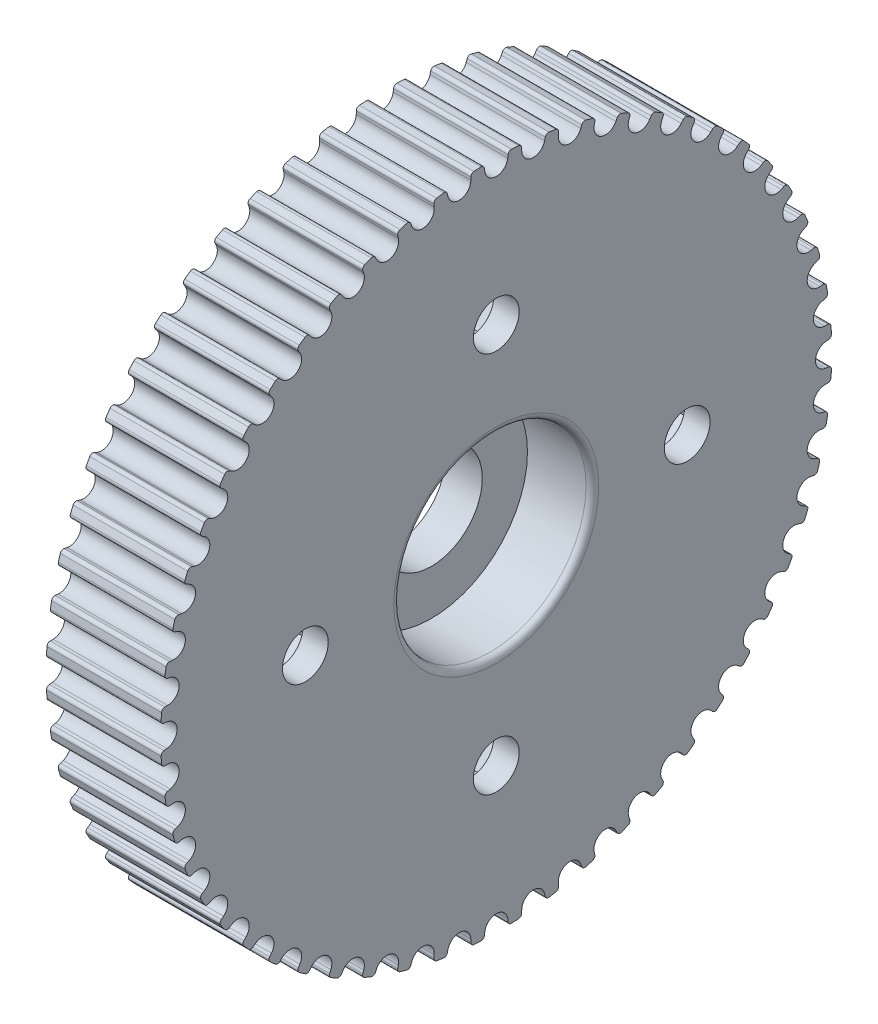
from build123d import *

# Parameters (mm, degrees)
CUT_EXTRUDE_2_REACH       = 40.348
PATTERN_CIRCULAR_3_COUNT  = 56
SKETCH_7_R                = 21.25
CUT_EXTRUDE_4_DEPTH       = 5
CHAMFER_1_SIZE            = 1
SKETCH_11_R               = 12.5
EXTRUDE_2_DEPTH           = 4
SKETCH_12_R               = 4
CUT_EXTRUDE_8_DEPTH       = 32
CHAMFER_3_SIZE            = 1
SKETCH_13_R               = 1.8
CUT_EXTRUDE_9_DEPTH       = 50
CUT_EXTRUDE_11_DEPTH      = 8
CUT_EXTRUDE_11_DEPTH_BACK = 2
SKETCH_15_R               = 7.55
CUT_EXTRUDE_12_DEPTH      = 5.1
FILLET_1_R                = 0.5


with BuildPart() as part:
    # 草图1 → 旋转1 (revolve)
    with BuildSketch(Plane.XY):
        Polygon((0, 5.2718), (0, 26.359), (9, 26.359), (9, 10.5436), (9, 0), (0, 0), align=None)
    revolve(axis=Axis((0, 0, 0), (1, 0, 0)))

    # 草图6 → 切除-拉伸2 (cut, up to next)
    with BuildSketch(Plane(origin=(0, 0, 0), x_dir=(0, 0, -1), z_dir=(1, 0, 0)), mode=Mode.PRIVATE) as cut_extrude_2_sk1:
        with BuildLine():
            Line((0.930903788, 26.103589707), (0.903216998, 25.878098898))
            ThreePointArc((0.903216998, 25.878098898), (0, 25.079), (-0.903216998, 25.878098898))
            Line((-0.903216998, 25.878098898), (-0.930903788, 26.103589707))
            ThreePointArc((-0.930903788, 26.103589707), (-1.021165973, 26.270506855), (-1.200810345, 26.331633742))
            ThreePointArc((-1.200810345, 26.331633742), (-1.330660773, 26.32539122), (-1.460478834, 26.318508365))
            Line((-1.460478834, 26.318508365), (-1.657126823, 27.920077708))
            ThreePointArc((-1.657126823, 27.920077708), (0, 27.969211796), (1.657126823, 27.920077708))
            Line((1.657126823, 27.920077708), (1.460478834, 26.318508365))
            ThreePointArc((1.460478834, 26.318508365), (1.330660773, 26.32539122), (1.200810345, 26.331633742))
            ThreePointArc((1.200810345, 26.331633742), (1.021165973, 26.270506855), (0.930903788, 26.103589707))
        make_face()
    cut_extrude_2_tool1 = extrude(cut_extrude_2_sk1.sketch, amount=CUT_EXTRUDE_2_REACH, mode=Mode.PRIVATE) & part.part
    cut_extrude_2 = cut_extrude_2_tool1.solids().sort_by_distance((0, 26.777178, 0))[0]
    add(cut_extrude_2, mode=Mode.SUBTRACT)

    # 阵列(圆周)3: 切除-拉伸2 ×56 about axis
    pattern_circular_3_axis = Axis((-0.45, 0, 0), (1, 0, 0))
    for i in range(1, PATTERN_CIRCULAR_3_COUNT):
        add(cut_extrude_2.rotate(pattern_circular_3_axis, i * 360 / PATTERN_CIRCULAR_3_COUNT), mode=Mode.SUBTRACT)

    # 草图7 → 切除-拉伸4 (cut)
    with BuildSketch(Plane.ZY):
        Circle(SKETCH_7_R)
    extrude(amount=-CUT_EXTRUDE_4_DEPTH, mode=Mode.SUBTRACT)

    # 倒角1
    chamfer_1_edges = [part.edges().sort_by_distance(p)[0] for p in [
        (0, 0, -21.25),
    ]]
    chamfer(chamfer_1_edges, length=CHAMFER_1_SIZE)

    # 草图11 → 凸台-拉伸2 (add)
    with BuildSketch(Plane.ZY.offset(-5)):
        Circle(SKETCH_11_R)
    extrude(amount=EXTRUDE_2_DEPTH)

    # 草图12 → 切除-拉伸8 (cut)
    with BuildSketch(Plane(origin=(9, 0, 0), x_dir=(0, 0, -1), z_dir=(1, 0, 0))):
        Circle(SKETCH_12_R)
    extrude(amount=-CUT_EXTRUDE_8_DEPTH, mode=Mode.SUBTRACT)

    # 倒角3
    chamfer_3_edges = [part.edges().sort_by_distance(p)[0] for p in [
        (1, 0, -12.5),
    ]]
    chamfer(chamfer_3_edges, length=CHAMFER_3_SIZE)

    # 草图13 → 切除-拉伸9 (cut)
    with BuildSketch(Plane(origin=(9, 0, 0), x_dir=(0, 0, -1), z_dir=(1, 0, 0))):
        with Locations((0, 15)):
            Circle(SKETCH_13_R)
        with Locations((15, 0)):
            Circle(SKETCH_13_R)
        with Locations((0, -15)):
            Circle(SKETCH_13_R)
        with Locations((-15, 0)):
            Circle(SKETCH_13_R)
    extrude(amount=-CUT_EXTRUDE_9_DEPTH, mode=Mode.SUBTRACT)

    # 草图14 → 切除-拉伸11 (cut, two sides: drawn at the far end of the back side and taken through both)
    with BuildSketch(Plane.ZY.offset(-5).offset(-CUT_EXTRUDE_11_DEPTH_BACK)):
        Polygon((3.290896534, 15), (1.645448267, 17.85), (-1.645448267, 17.85), (-3.290896534, 15), (-1.645448267, 12.15), (1.645448267, 12.15), align=None)
        Polygon((-15, 3.290896534), (-17.85, 1.645448267), (-17.85, -1.645448267), (-15, -3.290896534), (-12.15, -1.645448267), (-12.15, 1.645448267), align=None)
        Polygon((15, -3.290896534), (17.85, -1.645448267), (17.85, 1.645448267), (15, 3.290896534), (12.15, 1.645448267), (12.15, -1.645448267), align=None)
        Polygon((-3.290896534, -15), (-1.645448267, -17.85), (1.645448267, -17.85), (3.290896534, -15), (1.645448267, -12.15), (-1.645448267, -12.15), align=None)
    extrude(amount=CUT_EXTRUDE_11_DEPTH + CUT_EXTRUDE_11_DEPTH_BACK, mode=Mode.SUBTRACT)

    # 草图15 → 切除-拉伸12 (cut)
    with BuildSketch(Plane(origin=(9, 0, 0), x_dir=(0, 0, -1), z_dir=(1, 0, 0))):
        Circle(SKETCH_15_R)
    extrude(amount=-CUT_EXTRUDE_12_DEPTH, mode=Mode.SUBTRACT)

    # 圆角1
    fillet_1_edges = [part.edges().sort_by_distance(p)[0] for p in [
        (9, 0, 7.55),
    ]]
    fillet(fillet_1_edges, radius=FILLET_1_R)


solid = part.part
